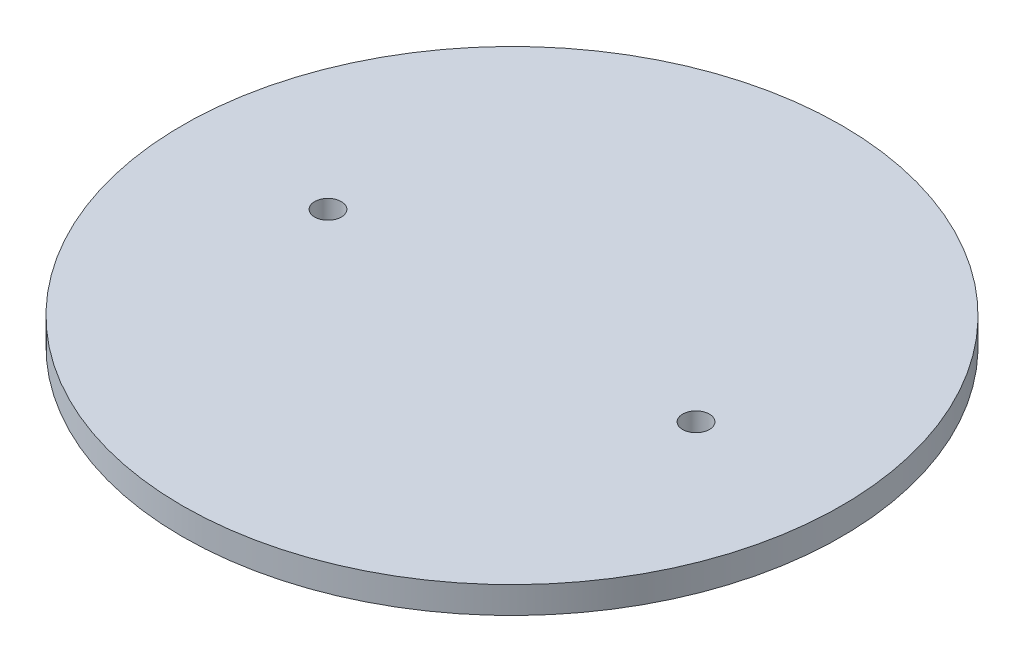
from build123d import *

# Parameters (mm, degrees)
SKETCH1_R           = 49.25
SKETCH1_R_2         = 2
BOSS_EXTRUDE1_DEPTH = 4


with BuildPart() as part:
    # Sketch1 → Boss-Extrude1 (new body)
    with BuildSketch(Plane(origin=(0, 0, 0), x_dir=(1, 0, 0), z_dir=(0, 1, 0))):
        Circle(SKETCH1_R)
        with Locations((-27.5, 0)):
            Circle(SKETCH1_R_2, mode=Mode.SUBTRACT)
        with Locations((27.5, 0)):
            Circle(SKETCH1_R_2, mode=Mode.SUBTRACT)
    extrude(amount=BOSS_EXTRUDE1_DEPTH)


solid = part.part
